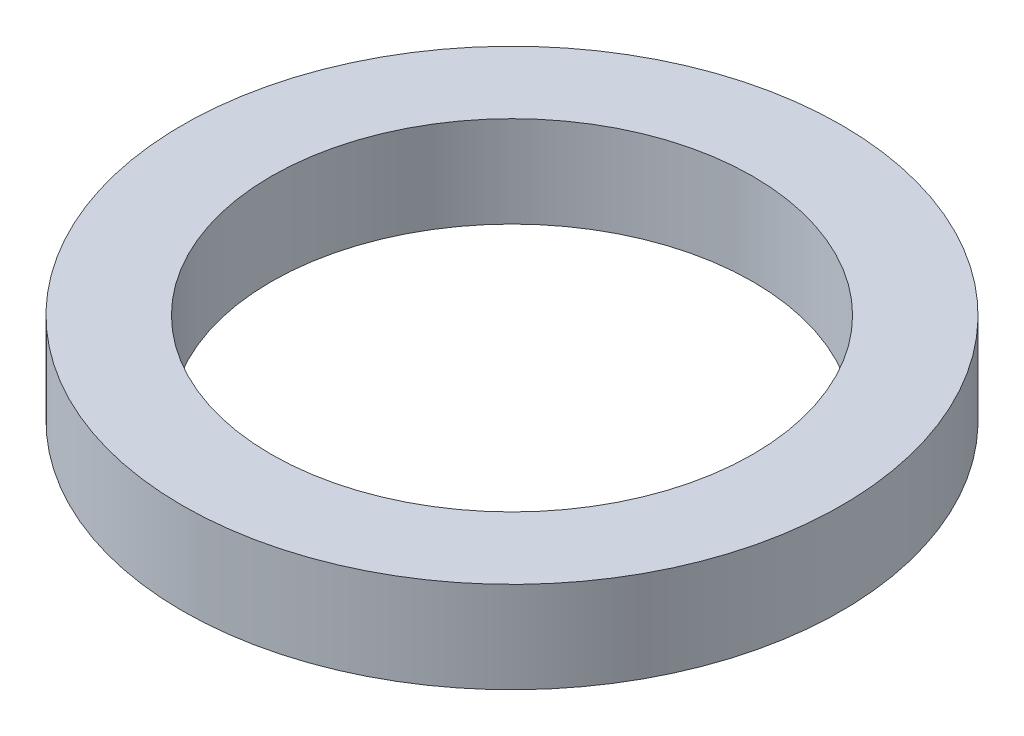
from build123d import *

# Parameters (mm, degrees)
SKETCH1_R           = 65
BOSS_EXTRUDE1_DEPTH = 18
SKETCH2_R           = 47.5
CUT_EXTRUDE1_DEPTH  = 94.669632219


with BuildPart() as part:
    # Sketch1 → Boss-Extrude1 (new body)
    with BuildSketch(Plane(origin=(0, 0, 0), x_dir=(1, 0, 0), z_dir=(0, 1, 0))):
        Circle(SKETCH1_R)
    extrude(amount=BOSS_EXTRUDE1_DEPTH)

    # Sketch2 → Cut-Extrude1 (cut, through all)
    with BuildSketch(Plane(origin=(0, 0, 0), x_dir=(1, 0, 0), z_dir=(0, 1, 0))):
        Circle(SKETCH2_R)
    extrude(amount=CUT_EXTRUDE1_DEPTH, mode=Mode.SUBTRACT)


solid = part.part
